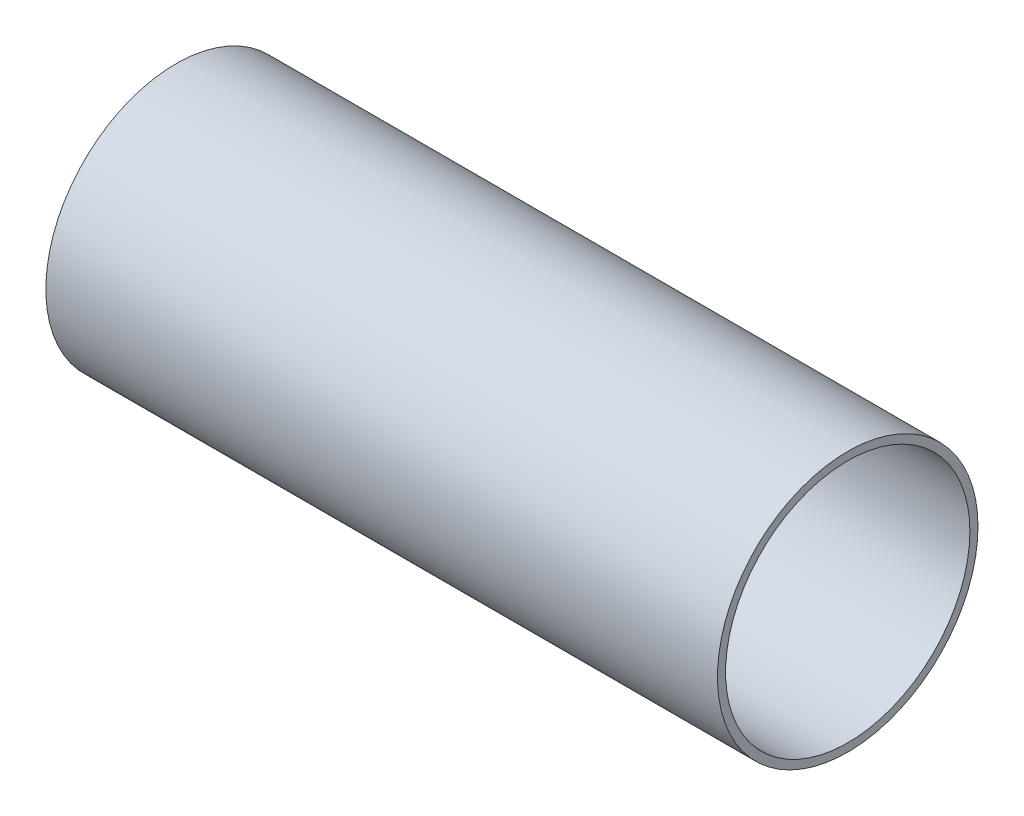
from build123d import *

# Parameters (mm, degrees)
SKETCH1_R           = 14.2875
SKETCH1_R_2         = 13.3985
BOSS_EXTRUDE1_DEPTH = 36.83


with BuildPart() as part:
    # Sketch1 → Boss-Extrude1 (new, symmetric)
    with BuildSketch(Plane(origin=(0, 0, 0), x_dir=(0, 0, -1), z_dir=(1, 0, 0))):
        Circle(SKETCH1_R)
        Circle(SKETCH1_R_2, mode=Mode.SUBTRACT)
    extrude(amount=BOSS_EXTRUDE1_DEPTH, both=True)


solid = part.part
